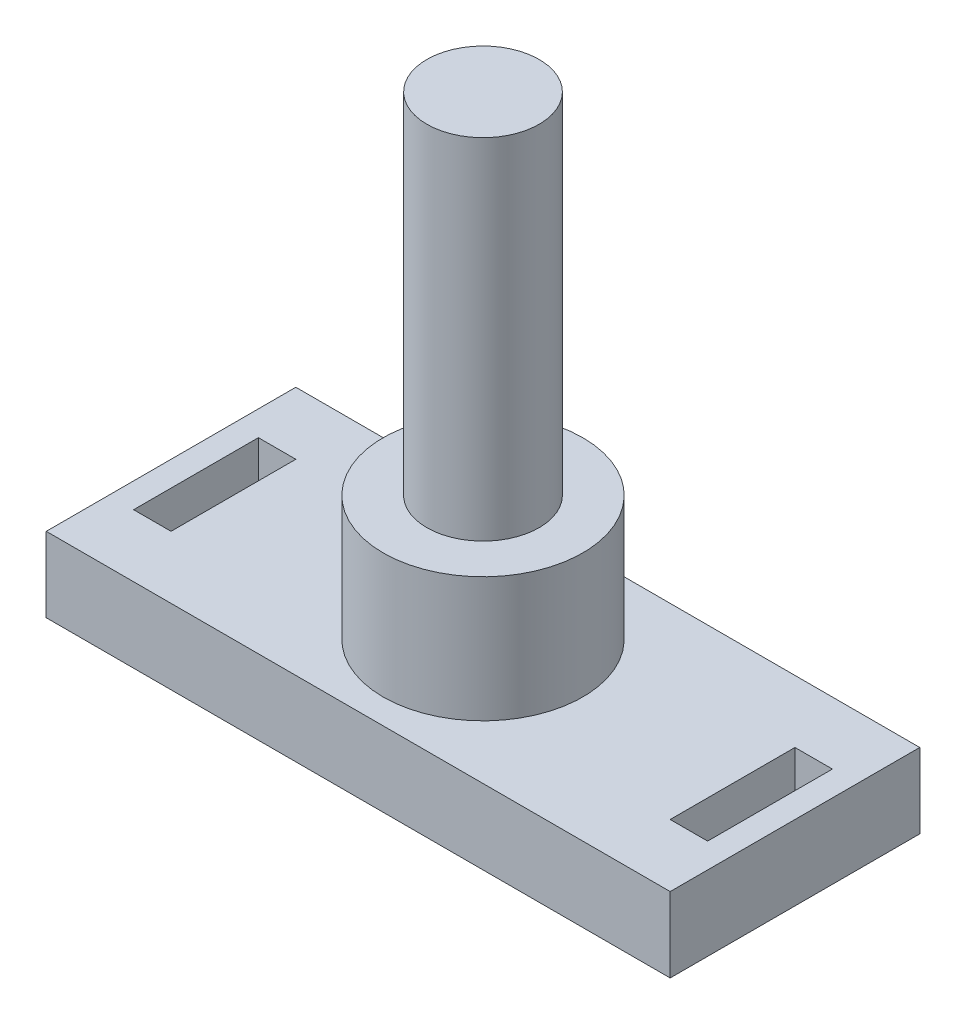
from build123d import *

# Parameters (mm, degrees)
SKETCH1_R           = 2.25
BOSS_EXTRUDE1_DEPTH = 14
SKETCH2_R           = 4
BOSS_EXTRUDE2_DEPTH = 5
SKETCH3_W           = 25
SKETCH3_H           = 10
BOSS_EXTRUDE3_DEPTH = 3
SKETCH4_W           = 1.5
SKETCH4_H           = 5
CUT_EXTRUDE1_DEPTH  = 3


with BuildPart() as part:
    # Sketch1 → Boss-Extrude1 (new body)
    with BuildSketch(Plane(origin=(0, 0, 0), x_dir=(1, 0, 0), z_dir=(0, 1, 0))):
        Circle(SKETCH1_R)
    extrude(amount=BOSS_EXTRUDE1_DEPTH)

    # Sketch2 → Boss-Extrude2 (add)
    with BuildSketch(Plane.XZ):
        Circle(SKETCH2_R)
    extrude(amount=BOSS_EXTRUDE2_DEPTH)

    # Sketch3 → Boss-Extrude3 (add)
    with BuildSketch(Plane.XZ.offset(5)):
        Rectangle(SKETCH3_W, SKETCH3_H)
    extrude(amount=BOSS_EXTRUDE3_DEPTH)

    # Sketch4 → Cut-Extrude1 (cut)
    with BuildSketch(Plane.XZ.offset(8)):
        with Locations((-10.75, 0)):
            Rectangle(SKETCH4_W, SKETCH4_H)
        with Locations((10.75, 0)):
            Rectangle(SKETCH4_W, SKETCH4_H)
    extrude(amount=-CUT_EXTRUDE1_DEPTH, mode=Mode.SUBTRACT)


solid = part.part
